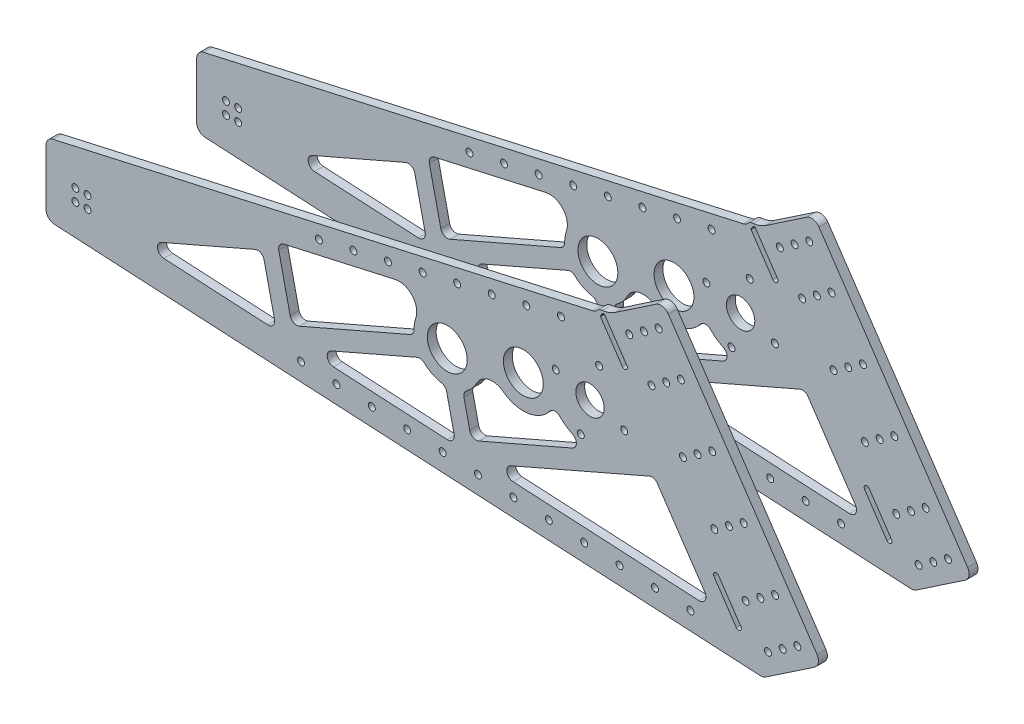
from build123d import *

# Parameters (mm, degrees)
BEARING_BLOCK_INTERFACE_PLATE_R   = 2.489199999999945
BEARING_BLOCK_INTERFACE_PLATE_R_2 = 2.4891999999999532
BEARING_BLOCK_INTERFACE_PLATE_R_3 = 2.4891999999998307
BOSS_EXTRUDE1_DEPTH               = 6.35
FILLET2_R                         = 6.35
PLATE_GB_R                        = 2.489199999999945
PLATE_GB_R_2                      = 2.4891999999998307
PLATE_GB_R_3                      = 14.287500000000026
PLATE_GB_R_4                      = 2.4891999999999532
PLATE_GB_R_5                      = 14.287500000000149
PLATE_GB_R_6                      = 2.4892000000000594
PLATE_GB_R_7                      = 10.159999999999924
PLATE_GB_R_8                      = 2.4891999999996024
BOSS_EXTRUDE2_DEPTH               = 6.35
FILLET1_R                         = 6.35
CUT_EXTRUDE1_REACH                = 774.478
TUBE_R                            = 2.4892000000000065
TUBE_R_2                          = 2.4892000000000594
TUBE_R_3                          = 2.4891999999998307
TUBE_R_4                          = 2.4891999999999532
TUBE_R_5                          = 2.489199999999945
CUT_EXTRUDE2_REACH                = 774.478
FILLET3_R                         = 4.7625
FILLET4_R                         = 0.635


with BuildPart() as part:
    # bearing block interface plate → Boss-Extrude1 (new body)
    with BuildSketch(Plane.XY.offset(57.15000000000033)):
        Polygon((529.0514377657089, 336.1483946681548), (571.1665464508059, 364.5553941639975), (684.7945444360628, 196.0949594208139), (642.6794357509659, 167.6879599249711), align=None)
        with Locations((646.1064630479871, 185.31848697026268)):
            Circle(BEARING_BLOCK_INTERFACE_PLATE_R, mode=Mode.SUBTRACT)
        with Locations((656.635240219436, 192.42023684434122)):
            Circle(BEARING_BLOCK_INTERFACE_PLATE_R, mode=Mode.SUBTRACT)
        with Locations((667.164017390885, 199.5219867184198)):
            Circle(BEARING_BLOCK_INTERFACE_PLATE_R, mode=Mode.SUBTRACT)
        with Locations((567.7395191537848, 346.92486711870583)):
            Circle(BEARING_BLOCK_INTERFACE_PLATE_R_2, mode=Mode.SUBTRACT)
        with Locations((557.2107419823359, 339.8231172446273)):
            Circle(BEARING_BLOCK_INTERFACE_PLATE_R_2, mode=Mode.SUBTRACT)
        with Locations((546.6819648108869, 332.7213673705488)):
            Circle(BEARING_BLOCK_INTERFACE_PLATE_R_3, mode=Mode.SUBTRACT)
        with Locations((562.6609020275637, 309.03161873478854)):
            Circle(BEARING_BLOCK_INTERFACE_PLATE_R_3, mode=Mode.SUBTRACT)
        with Locations((573.189679199013, 316.133368608867)):
            Circle(BEARING_BLOCK_INTERFACE_PLATE_R_2, mode=Mode.SUBTRACT)
        with Locations((583.7184563704618, 323.2351184829455)):
            Circle(BEARING_BLOCK_INTERFACE_PLATE_R_2, mode=Mode.SUBTRACT)
        with Locations((606.2073309717106, 289.8939907733571)):
            Circle(BEARING_BLOCK_INTERFACE_PLATE_R_2, mode=Mode.SUBTRACT)
        with Locations((595.6785538002617, 282.7922408992787)):
            Circle(BEARING_BLOCK_INTERFACE_PLATE_R_2, mode=Mode.SUBTRACT)
        with Locations((585.1497766288124, 275.69049102520023)):
            Circle(BEARING_BLOCK_INTERFACE_PLATE_R_3, mode=Mode.SUBTRACT)
        with Locations((628.6962055729593, 256.55286306376865)):
            Circle(BEARING_BLOCK_INTERFACE_PLATE_R_2, mode=Mode.SUBTRACT)
        with Locations((618.1674284015103, 249.45111318969037)):
            Circle(BEARING_BLOCK_INTERFACE_PLATE_R_2, mode=Mode.SUBTRACT)
        with Locations((607.638651230061, 242.3493633156119)):
            Circle(BEARING_BLOCK_INTERFACE_PLATE_R_3, mode=Mode.SUBTRACT)
        with Locations((651.1850801742079, 223.21173535418063)):
            Circle(BEARING_BLOCK_INTERFACE_PLATE_R, mode=Mode.SUBTRACT)
        with Locations((640.656303002759, 216.1099854801021)):
            Circle(BEARING_BLOCK_INTERFACE_PLATE_R, mode=Mode.SUBTRACT)
        with Locations((630.1275258313098, 209.00823560602365)):
            Circle(BEARING_BLOCK_INTERFACE_PLATE_R_3, mode=Mode.SUBTRACT)
    extrude(amount=-BOSS_EXTRUDE1_DEPTH)

    # Fillet2
    fillet2_edges = [part.edges().sort_by_distance(p)[0] for p in [
        (642.6794357509659, 167.6879599249711, 53.975000000000335),
        (571.1665464508059, 364.5553941639975, 53.975000000000335),
        (529.0514377657089, 336.1483946681548, 53.975000000000335),
        (684.7945444360628, 196.0949594208139, 53.975000000000335),
    ]]
    fillet(fillet2_edges, radius=FILLET2_R)

    # plate+gb → Boss-Extrude2 (add)
    with BuildSketch(Plane.XY.offset(57.15000000000033)):
        with BuildLine():
            Line((128.73734233150986, 246.1260000000246), (128.73734233150986, 195.32600000002458))
            Line((128.73734233150986, 195.32600000002458), (642.6794357509659, 167.6879599249711))
            Line((642.6794357509659, 167.6879599249711), (684.7945444360628, 196.0949594208139))
            Line((684.7945444360628, 196.0949594208139), (571.1665464508058, 364.5553941639974))
            Line((571.1665464508058, 364.5553941639974), (536.5393493982891, 341.1990548376937))
            ThreePointArc((536.5393493982891, 341.19905483769367), (532.27553378646, 339.04547668364233), (527.6100125053204, 338.02032615200346))
            ThreePointArc((527.6100125053204, 338.02032615200335), (524.7494784778174, 337.0010093937264), (522.735638532723, 334.7281015091546))
            Line((522.735638532723, 334.7281015091547), (128.73734233150986, 246.1260000000246))
        make_face()
        with BuildLine():
            Line((541.7142246921655, 310.2218744185116), (525.976365604832, 333.55421002934514))
            ThreePointArc((525.9763656048323, 333.55421002934526), (526.9975356247328, 335.313412133839), (528.4731202472173, 336.7134943728115))
            ThreePointArc((528.4731202472174, 336.7134943728114), (528.7911345943266, 336.46047504727386), (529.0514377657092, 336.14839466815505))
            Line((529.0514377657091, 336.148394668155), (545.0303749823858, 312.45864603239465))
            ThreePointArc((545.0303749823858, 312.4586460323946), (544.490685644217, 309.6821850803432), (541.7142246921655, 310.22187441851156))
        make_face(mode=Mode.SUBTRACT)
        with Locations((646.1064630479871, 185.31848697026268)):
            Circle(PLATE_GB_R, mode=Mode.SUBTRACT)
        with BuildLine():
            ThreePointArc((607.4054110273914, 212.83068558260925), (607.94510036556, 215.60714653466047), (610.7215613176113, 215.06745719649211))
            Line((610.7215613176113, 215.0674571964921), (626.7004985342884, 191.37770856073158))
            ThreePointArc((626.7004985342884, 191.37770856073155), (626.1608091961198, 188.60124760867996), (623.3843482440682, 189.14093694684863))
            Line((623.3843482440683, 189.14093694684865), (607.4054110273914, 212.83068558260925))
        make_face(mode=Mode.SUBTRACT)
        with Locations((656.635240219436, 192.42023684434122)):
            Circle(PLATE_GB_R, mode=Mode.SUBTRACT)
        with Locations((667.164017390885, 199.5219867184198)):
            Circle(PLATE_GB_R, mode=Mode.SUBTRACT)
        with Locations((630.1275258313098, 209.00823560602365)):
            Circle(PLATE_GB_R_2, mode=Mode.SUBTRACT)
        with Locations((640.656303002759, 216.1099854801021)):
            Circle(PLATE_GB_R, mode=Mode.SUBTRACT)
        with Locations((416.28658066690326, 258.72124542384995)):
            Circle(PLATE_GB_R_3, mode=Mode.SUBTRACT)
        with Locations((511.9960146960638, 253.34148401228222)):
            Circle(PLATE_GB_R_4, mode=Mode.SUBTRACT)
        with Locations((651.1850801742079, 223.21173535418063)):
            Circle(PLATE_GB_R, mode=Mode.SUBTRACT)
        with Locations((607.638651230061, 242.3493633156119)):
            Circle(PLATE_GB_R_2, mode=Mode.SUBTRACT)
        with Locations((618.1674284015103, 249.45111318969037)):
            Circle(PLATE_GB_R_4, mode=Mode.SUBTRACT)
        with Locations((628.6962055729593, 256.55286306376865)):
            Circle(PLATE_GB_R_4, mode=Mode.SUBTRACT)
        with Locations((470.8050615222699, 270.9813288339667)):
            Circle(PLATE_GB_R_5, mode=Mode.SUBTRACT)
        with Locations((543.1045344294101, 271.3019962544207)):
            Circle(PLATE_GB_R_6, mode=Mode.SUBTRACT)
        with Locations((518.5700184416677, 277.8760000000246)):
            Circle(PLATE_GB_R_7, mode=Mode.SUBTRACT)
        with Locations((494.03550245392535, 284.45000374562846)):
            Circle(PLATE_GB_R_8, mode=Mode.SUBTRACT)
        with Locations((525.1440221872716, 302.410515987767)):
            Circle(PLATE_GB_R_2, mode=Mode.SUBTRACT)
        with Locations((585.1497766288124, 275.69049102520023)):
            Circle(PLATE_GB_R_2, mode=Mode.SUBTRACT)
        with Locations((595.6785538002617, 282.7922408992787)):
            Circle(PLATE_GB_R_4, mode=Mode.SUBTRACT)
        with Locations((606.2073309717106, 289.8939907733571)):
            Circle(PLATE_GB_R_4, mode=Mode.SUBTRACT)
        with Locations((562.6609020275637, 309.03161873478854)):
            Circle(PLATE_GB_R_2, mode=Mode.SUBTRACT)
        with Locations((573.189679199013, 316.133368608867)):
            Circle(PLATE_GB_R_4, mode=Mode.SUBTRACT)
        with Locations((583.7184563704618, 323.2351184829455)):
            Circle(PLATE_GB_R_4, mode=Mode.SUBTRACT)
        with Locations((546.6819648108869, 332.7213673705488)):
            Circle(PLATE_GB_R_2, mode=Mode.SUBTRACT)
        with Locations((557.2107419823359, 339.8231172446273)):
            Circle(PLATE_GB_R_4, mode=Mode.SUBTRACT)
        with Locations((567.7395191537848, 346.92486711870583)):
            Circle(PLATE_GB_R_4, mode=Mode.SUBTRACT)
    extrude(amount=-BOSS_EXTRUDE2_DEPTH)

    # Fillet1
    fillet1_edges = [part.edges().sort_by_distance(p)[0] for p in [
        (128.73734233150986, 195.32600000002458, 53.975000000000335),
        (128.73734233150986, 246.1260000000246, 53.975000000000335),
        (571.1665464508058, 364.5553941639974, 53.975000000000335),
        (642.6794357509659, 167.6879599249711, 53.975000000000335),
        (684.7945444360628, 196.0949594208139, 53.975000000000335),
        (522.735638532723, 334.72810150915467, 53.975000000000335),
    ]]
    fillet(fillet1_edges, radius=FILLET1_R)

    # tube → Cut-Extrude1 (cut, up to next)
    with BuildSketch(Plane.XY.offset(57.15000000000033), mode=Mode.PRIVATE) as cut_extrude1_sk1:
        with Locations((149.77382178328023, 225.08952054825406)):
            Circle(TUBE_R)
    cut_extrude1_tool1 = extrude(cut_extrude1_sk1.sketch, amount=-CUT_EXTRUDE1_REACH, mode=Mode.PRIVATE) & part.part
    # tube → Cut-Extrude1 (cut, up to next)
    with BuildSketch(Plane.XY.offset(57.15000000000033), mode=Mode.PRIVATE) as cut_extrude1_sk2:
        with Locations((158.50086287973946, 225.0895205482541)):
            Circle(TUBE_R)
    cut_extrude1_tool2 = extrude(cut_extrude1_sk2.sketch, amount=-CUT_EXTRUDE1_REACH, mode=Mode.PRIVATE) & part.part
    # tube → Cut-Extrude1 (cut, up to next)
    with BuildSketch(Plane.XY.offset(57.15000000000033), mode=Mode.PRIVATE) as cut_extrude1_sk3:
        with Locations((158.50086287973946, 216.36247945179488)):
            Circle(TUBE_R)
    cut_extrude1_tool3 = extrude(cut_extrude1_sk3.sketch, amount=-CUT_EXTRUDE1_REACH, mode=Mode.PRIVATE) & part.part
    # tube → Cut-Extrude1 (cut, up to next)
    with BuildSketch(Plane.XY.offset(57.15000000000033), mode=Mode.PRIVATE) as cut_extrude1_sk4:
        with Locations((149.77382178328028, 216.36247945179488)):
            Circle(TUBE_R_2)
    cut_extrude1_tool4 = extrude(cut_extrude1_sk4.sketch, amount=-CUT_EXTRUDE1_REACH, mode=Mode.PRIVATE) & part.part
    # tube → Cut-Extrude1 (cut, up to next)
    with BuildSketch(Plane.XY.offset(57.15000000000033), mode=Mode.PRIVATE) as cut_extrude1_sk5:
        with Locations((497.7285010763347, 319.34163846208315)):
            Circle(TUBE_R_3)
    cut_extrude1_tool5 = extrude(cut_extrude1_sk5.sketch, amount=-CUT_EXTRUDE1_REACH, mode=Mode.PRIVATE) & part.part
    # tube → Cut-Extrude1 (cut, up to next)
    with BuildSketch(Plane.XY.offset(57.15000000000033), mode=Mode.PRIVATE) as cut_extrude1_sk6:
        with Locations((472.9473734148044, 313.76887327566646)):
            Circle(TUBE_R_4)
    cut_extrude1_tool6 = extrude(cut_extrude1_sk6.sketch, amount=-CUT_EXTRUDE1_REACH, mode=Mode.PRIVATE) & part.part
    # tube → Cut-Extrude1 (cut, up to next)
    with BuildSketch(Plane.XY.offset(57.15000000000033), mode=Mode.PRIVATE) as cut_extrude1_sk7:
        with Locations((448.16624575327415, 308.1961080892497)):
            Circle(TUBE_R_4)
    cut_extrude1_tool7 = extrude(cut_extrude1_sk7.sketch, amount=-CUT_EXTRUDE1_REACH, mode=Mode.PRIVATE) & part.part
    # tube → Cut-Extrude1 (cut, up to next)
    with BuildSketch(Plane.XY.offset(57.15000000000033), mode=Mode.PRIVATE) as cut_extrude1_sk8:
        with Locations((423.38511809174383, 302.62334290283303)):
            Circle(TUBE_R_4)
    cut_extrude1_tool8 = extrude(cut_extrude1_sk8.sketch, amount=-CUT_EXTRUDE1_REACH, mode=Mode.PRIVATE) & part.part
    # tube → Cut-Extrude1 (cut, up to next)
    with BuildSketch(Plane.XY.offset(57.15000000000033), mode=Mode.PRIVATE) as cut_extrude1_sk9:
        with Locations((398.60399043021357, 297.05057771641634)):
            Circle(TUBE_R_4)
    cut_extrude1_tool9 = extrude(cut_extrude1_sk9.sketch, amount=-CUT_EXTRUDE1_REACH, mode=Mode.PRIVATE) & part.part
    # tube → Cut-Extrude1 (cut, up to next)
    with BuildSketch(Plane.XY.offset(57.15000000000033), mode=Mode.PRIVATE) as cut_extrude1_sk10:
        with Locations((373.82286276868325, 291.47781252999965)):
            Circle(TUBE_R_3)
    cut_extrude1_tool10 = extrude(cut_extrude1_sk10.sketch, amount=-CUT_EXTRUDE1_REACH, mode=Mode.PRIVATE) & part.part
    # tube → Cut-Extrude1 (cut, up to next)
    with BuildSketch(Plane.XY.offset(57.15000000000033), mode=Mode.PRIVATE) as cut_extrude1_sk11:
        with Locations((590.5082808024525, 183.21189582536667)):
            Circle(TUBE_R_5)
    cut_extrude1_tool11 = extrude(cut_extrude1_sk11.sketch, amount=-CUT_EXTRUDE1_REACH, mode=Mode.PRIVATE) & part.part
    # tube → Cut-Extrude1 (cut, up to next)
    with BuildSketch(Plane.XY.offset(57.15000000000033), mode=Mode.PRIVATE) as cut_extrude1_sk12:
        with Locations((565.144928704245, 184.5758497624026)):
            Circle(TUBE_R_5)
    cut_extrude1_tool12 = extrude(cut_extrude1_sk12.sketch, amount=-CUT_EXTRUDE1_REACH, mode=Mode.PRIVATE) & part.part
    # tube → Cut-Extrude1 (cut, up to next)
    with BuildSketch(Plane.XY.offset(57.15000000000033), mode=Mode.PRIVATE) as cut_extrude1_sk13:
        with Locations((539.7815766060377, 185.93980369943853)):
            Circle(TUBE_R_5)
    cut_extrude1_tool13 = extrude(cut_extrude1_sk13.sketch, amount=-CUT_EXTRUDE1_REACH, mode=Mode.PRIVATE) & part.part
    # tube → Cut-Extrude1 (cut, up to next)
    with BuildSketch(Plane.XY.offset(57.15000000000033), mode=Mode.PRIVATE) as cut_extrude1_sk14:
        with Locations((514.4182245078301, 187.30375763647444)):
            Circle(TUBE_R_5)
    cut_extrude1_tool14 = extrude(cut_extrude1_sk14.sketch, amount=-CUT_EXTRUDE1_REACH, mode=Mode.PRIVATE) & part.part
    # tube → Cut-Extrude1 (cut, up to next)
    with BuildSketch(Plane.XY.offset(57.15000000000033), mode=Mode.PRIVATE) as cut_extrude1_sk15:
        with Locations((489.05487240962265, 188.66771157351036)):
            Circle(TUBE_R_5)
    cut_extrude1_tool15 = extrude(cut_extrude1_sk15.sketch, amount=-CUT_EXTRUDE1_REACH, mode=Mode.PRIVATE) & part.part
    # tube → Cut-Extrude1 (cut, up to next)
    with BuildSketch(Plane.XY.offset(57.15000000000033), mode=Mode.PRIVATE) as cut_extrude1_sk16:
        with Locations((463.6915203114152, 190.03166551054628)):
            Circle(TUBE_R_5)
    cut_extrude1_tool16 = extrude(cut_extrude1_sk16.sketch, amount=-CUT_EXTRUDE1_REACH, mode=Mode.PRIVATE) & part.part
    # tube → Cut-Extrude1 (cut, up to next)
    with BuildSketch(Plane.XY.offset(57.15000000000033), mode=Mode.PRIVATE) as cut_extrude1_sk17:
        with Locations((438.32816821320773, 191.39561944758222)):
            Circle(TUBE_R_5)
    cut_extrude1_tool17 = extrude(cut_extrude1_sk17.sketch, amount=-CUT_EXTRUDE1_REACH, mode=Mode.PRIVATE) & part.part
    # tube → Cut-Extrude1 (cut, up to next)
    with BuildSketch(Plane.XY.offset(57.15000000000033), mode=Mode.PRIVATE) as cut_extrude1_sk18:
        with Locations((412.96481611500025, 192.75957338461814)):
            Circle(TUBE_R_5)
    cut_extrude1_tool18 = extrude(cut_extrude1_sk18.sketch, amount=-CUT_EXTRUDE1_REACH, mode=Mode.PRIVATE) & part.part
    # tube → Cut-Extrude1 (cut, up to next)
    with BuildSketch(Plane.XY.offset(57.15000000000033), mode=Mode.PRIVATE) as cut_extrude1_sk19:
        with Locations((387.6014640167928, 194.12352732165405)):
            Circle(TUBE_R_5)
    cut_extrude1_tool19 = extrude(cut_extrude1_sk19.sketch, amount=-CUT_EXTRUDE1_REACH, mode=Mode.PRIVATE) & part.part
    # tube → Cut-Extrude1 (cut, up to next)
    with BuildSketch(Plane.XY.offset(57.15000000000033), mode=Mode.PRIVATE) as cut_extrude1_sk20:
        with Locations((362.23811191858533, 195.48748125868997)):
            Circle(TUBE_R_5)
    cut_extrude1_tool20 = extrude(cut_extrude1_sk20.sketch, amount=-CUT_EXTRUDE1_REACH, mode=Mode.PRIVATE) & part.part
    # tube → Cut-Extrude1 (cut, up to next)
    with BuildSketch(Plane.XY.offset(57.15000000000033), mode=Mode.PRIVATE) as cut_extrude1_sk21:
        with Locations((336.87475982037785, 196.8514351957259)):
            Circle(TUBE_R_5)
    cut_extrude1_tool21 = extrude(cut_extrude1_sk21.sketch, amount=-CUT_EXTRUDE1_REACH, mode=Mode.PRIVATE) & part.part
    # tube → Cut-Extrude1 (cut, up to next)
    with BuildSketch(Plane.XY.offset(57.15000000000033), mode=Mode.PRIVATE) as cut_extrude1_sk22:
        with Locations((311.5114077221704, 198.21538913276183)):
            Circle(TUBE_R_5)
    cut_extrude1_tool22 = extrude(cut_extrude1_sk22.sketch, amount=-CUT_EXTRUDE1_REACH, mode=Mode.PRIVATE) & part.part
    # tube → Cut-Extrude1 (cut, up to next)
    with BuildSketch(Plane.XY.offset(57.15000000000033), mode=Mode.PRIVATE) as cut_extrude1_sk23:
        with Locations((349.04173510715304, 285.90504734358296)):
            Circle(TUBE_R_3)
    cut_extrude1_tool23 = extrude(cut_extrude1_sk23.sketch, amount=-CUT_EXTRUDE1_REACH, mode=Mode.PRIVATE) & part.part
    # tube → Cut-Extrude1 (cut, up to next)
    with BuildSketch(Plane.XY.offset(57.15000000000033), mode=Mode.PRIVATE) as cut_extrude1_sk24:
        with Locations((324.2606074456227, 280.3322821571662)):
            Circle(TUBE_R_4)
    cut_extrude1_tool24 = extrude(cut_extrude1_sk24.sketch, amount=-CUT_EXTRUDE1_REACH, mode=Mode.PRIVATE) & part.part
    add(cut_extrude1_tool1.solids().sort_by_distance((149.773822, 225.089521, 57.15))[0], mode=Mode.SUBTRACT)
    add(cut_extrude1_tool2.solids().sort_by_distance((158.500863, 225.089521, 57.15))[0], mode=Mode.SUBTRACT)
    add(cut_extrude1_tool3.solids().sort_by_distance((158.500863, 216.362479, 57.15))[0], mode=Mode.SUBTRACT)
    add(cut_extrude1_tool4.solids().sort_by_distance((149.773822, 216.362479, 57.15))[0], mode=Mode.SUBTRACT)
    add(cut_extrude1_tool5.solids().sort_by_distance((497.728501, 319.341638, 57.15))[0], mode=Mode.SUBTRACT)
    add(cut_extrude1_tool6.solids().sort_by_distance((472.947373, 313.768873, 57.15))[0], mode=Mode.SUBTRACT)
    add(cut_extrude1_tool7.solids().sort_by_distance((448.166246, 308.196108, 57.15))[0], mode=Mode.SUBTRACT)
    add(cut_extrude1_tool8.solids().sort_by_distance((423.385118, 302.623343, 57.15))[0], mode=Mode.SUBTRACT)
    add(cut_extrude1_tool9.solids().sort_by_distance((398.60399, 297.050578, 57.15))[0], mode=Mode.SUBTRACT)
    add(cut_extrude1_tool10.solids().sort_by_distance((373.822863, 291.477813, 57.15))[0], mode=Mode.SUBTRACT)
    add(cut_extrude1_tool11.solids().sort_by_distance((590.508281, 183.211896, 57.15))[0], mode=Mode.SUBTRACT)
    add(cut_extrude1_tool12.solids().sort_by_distance((565.144929, 184.57585, 57.15))[0], mode=Mode.SUBTRACT)
    add(cut_extrude1_tool13.solids().sort_by_distance((539.781577, 185.939804, 57.15))[0], mode=Mode.SUBTRACT)
    add(cut_extrude1_tool14.solids().sort_by_distance((514.418225, 187.303758, 57.15))[0], mode=Mode.SUBTRACT)
    add(cut_extrude1_tool15.solids().sort_by_distance((489.054872, 188.667712, 57.15))[0], mode=Mode.SUBTRACT)
    add(cut_extrude1_tool16.solids().sort_by_distance((463.69152, 190.031666, 57.15))[0], mode=Mode.SUBTRACT)
    add(cut_extrude1_tool17.solids().sort_by_distance((438.328168, 191.395619, 57.15))[0], mode=Mode.SUBTRACT)
    add(cut_extrude1_tool18.solids().sort_by_distance((412.964816, 192.759573, 57.15))[0], mode=Mode.SUBTRACT)
    add(cut_extrude1_tool19.solids().sort_by_distance((387.601464, 194.123527, 57.15))[0], mode=Mode.SUBTRACT)
    add(cut_extrude1_tool20.solids().sort_by_distance((362.238112, 195.487481, 57.15))[0], mode=Mode.SUBTRACT)
    add(cut_extrude1_tool21.solids().sort_by_distance((336.87476, 196.851435, 57.15))[0], mode=Mode.SUBTRACT)
    add(cut_extrude1_tool22.solids().sort_by_distance((311.511408, 198.215389, 57.15))[0], mode=Mode.SUBTRACT)
    add(cut_extrude1_tool23.solids().sort_by_distance((349.041735, 285.905047, 57.15))[0], mode=Mode.SUBTRACT)
    add(cut_extrude1_tool24.solids().sort_by_distance((324.260607, 280.332282, 57.15))[0], mode=Mode.SUBTRACT)

    # Sketch20 → Cut-Extrude2 (cut, up to next)
    with BuildSketch(Plane.XY.offset(57.15000000000033), mode=Mode.PRIVATE) as cut_extrude2_sk1:
        Polygon((283.7782182408136, 253.59394234449184), (193.02712039136657, 214.1258298591775), (293.87334152601755, 208.70266655571493), align=None)
    cut_extrude2_tool1 = extrude(cut_extrude2_sk1.sketch, amount=-CUT_EXTRUDE2_REACH, mode=Mode.PRIVATE) & part.part
    # Sketch20 → Cut-Extrude2 (cut, up to next)
    with BuildSketch(Plane.XY.offset(57.15000000000033), mode=Mode.PRIVATE) as cut_extrude2_sk2:
        with BuildLine():
            Line((397.7730730126499, 243.7450913586069), (314.6314269698162, 207.58636803741302))
            Line((314.6314269698162, 207.58636803741308), (422.5826597553713, 201.78112161747538))
            Line((422.58265975537137, 201.7811216174754), (415.1265819839163, 234.93701620982114))
            ThreePointArc((415.126581983916, 234.93701620982102), (405.5089529197121, 237.48735985401194), (397.77307301264995, 243.74509135860666))
        make_face()
    cut_extrude2_tool2 = extrude(cut_extrude2_sk2.sketch, amount=-CUT_EXTRUDE2_REACH, mode=Mode.PRIVATE) & part.part
    # Sketch20 → Cut-Extrude2 (cut, up to next)
    with BuildSketch(Plane.XY.offset(57.15000000000033), mode=Mode.PRIVATE) as cut_extrude2_sk3:
        with BuildLine():
            Line((304.9718820421919, 217.2344544602027), (392.70805195930586, 255.3913595046347))
            ThreePointArc((392.7080519593054, 255.39135950463523), (392.57852746394303, 260.94910753260035), (393.741172300006, 266.38542951740084))
            ThreePointArc((393.7411723000059, 266.38542951740084), (391.16240743211694, 278.96260089462623), (378.93057191111905, 282.86355819805976))
            Line((378.93057191111905, 282.8635581980597), (294.4837853667419, 263.87321528118673))
            Line((294.483785366742, 263.87321528118673), (304.9718820421919, 217.2344544602027))
        make_face()
    cut_extrude2_tool3 = extrude(cut_extrude2_sk3.sketch, amount=-CUT_EXTRUDE2_REACH, mode=Mode.PRIVATE) & part.part
    # Sketch20 → Cut-Extrude2 (cut, up to next)
    with BuildSketch(Plane.XY.offset(57.15000000000033), mode=Mode.PRIVATE) as cut_extrude2_sk4:
        Polygon((564.6938350728718, 253.44189704181008), (443.3407451991701, 200.66482309917347), (606.1997655838906, 191.9068245043722), align=None)
    cut_extrude2_tool4 = extrude(cut_extrude2_sk4.sketch, amount=-CUT_EXTRUDE2_REACH, mode=Mode.PRIVATE) & part.part
    # Sketch20 → Cut-Extrude2 (cut, up to next)
    with BuildSketch(Plane.XY.offset(57.15000000000033), mode=Mode.PRIVATE) as cut_extrude2_sk5:
        with BuildLine():
            ThreePointArc((437.4277117876691, 247.7627906429703), (433.232938002764, 241.99234440509446), (427.5171458146811, 237.7233988030291))
            Line((427.51714581468167, 237.72339880302906), (433.6812002715457, 210.31290952196312))
            Line((433.6812002715457, 210.31290952196312), (519.7296081727479, 247.7357983101625))
            ThreePointArc((519.7296081727479, 247.73579831016238), (504.36792965000797, 251.2662822224191), (492.8846159595747, 262.0634573334294))
            ThreePointArc((492.88461595957466, 262.0634573334294), (477.11936489850655, 248.0212606911487), (456.39066165040543, 252.02716748127182))
            ThreePointArc((456.39066165040543, 252.0271674812718), (445.9165991255359, 254.30884525726637), (437.4277117876691, 247.7627906429703))
        make_face()
    cut_extrude2_tool5 = extrude(cut_extrude2_sk5.sketch, amount=-CUT_EXTRUDE2_REACH, mode=Mode.PRIVATE) & part.part
    add(cut_extrude2_tool1.solids().sort_by_distance((256.892893, 225.474146, 57.15))[0], mode=Mode.SUBTRACT)
    add(cut_extrude2_tool2.solids().sort_by_distance((381.543889, 218.429138, 57.15))[0], mode=Mode.SUBTRACT)
    add(cut_extrude2_tool3.solids().sort_by_distance((342.159835, 254.458367, 57.15))[0], mode=Mode.SUBTRACT)
    add(cut_extrude2_tool4.solids().sort_by_distance((538.078115, 215.337848, 57.15))[0], mode=Mode.SUBTRACT)
    add(cut_extrude2_tool5.solids().sort_by_distance((463.243993, 237.371256, 57.15))[0], mode=Mode.SUBTRACT)

    # Fillet3
    fillet3_edges = [part.edges().sort_by_distance(p)[0] for p in [
        (392.70805195930564, 255.39135950463498, 53.975000000000335),
        (304.9718820421919, 217.2344544602027, 53.975000000000335),
        (294.4837853667419, 263.87321528118673, 53.975000000000335),
        (492.8846159595747, 262.0634573334294, 53.975000000000335),
        (519.7296081727479, 247.73579831016247, 53.975000000000335),
        (433.6812002715457, 210.31290952196312, 53.975000000000335),
        (427.5171458146814, 237.72339880302908, 53.975000000000335),
        (564.6938350728717, 253.44189704181005, 53.975000000000335),
        (606.1997655838906, 191.9068245043722, 53.975000000000335),
        (443.3407451991701, 200.66482309917347, 53.975000000000335),
        (415.12658198391614, 234.93701620982108, 53.975000000000335),
        (422.5826597553713, 201.78112161747538, 53.975000000000335),
        (314.6314269698162, 207.58636803741305, 53.975000000000335),
        (397.7730730126499, 243.74509135860677, 53.975000000000335),
        (283.7782182408136, 253.59394234449184, 53.975000000000335),
        (293.8733415260176, 208.70266655571493, 53.975000000000335),
        (193.02712039136657, 214.12582985917754, 53.975000000000335),
    ]]
    fillet(fillet3_edges, radius=FILLET3_R)

    # Fillet4
    fillet4_edges = [part.edges().sort_by_distance(p)[0] for p in [
        (528.4731202472174, 336.71349437281145, 53.975000000000335),
        (525.9763656048322, 333.5542100293452, 53.975000000000335),
    ]]
    fillet(fillet4_edges, radius=FILLET4_R)


with BuildPart() as body_2:
    # Mirror1: mirrored copy
    add(part.part.mirror(Plane.XY))


solid = Compound([part.part, body_2.part])
